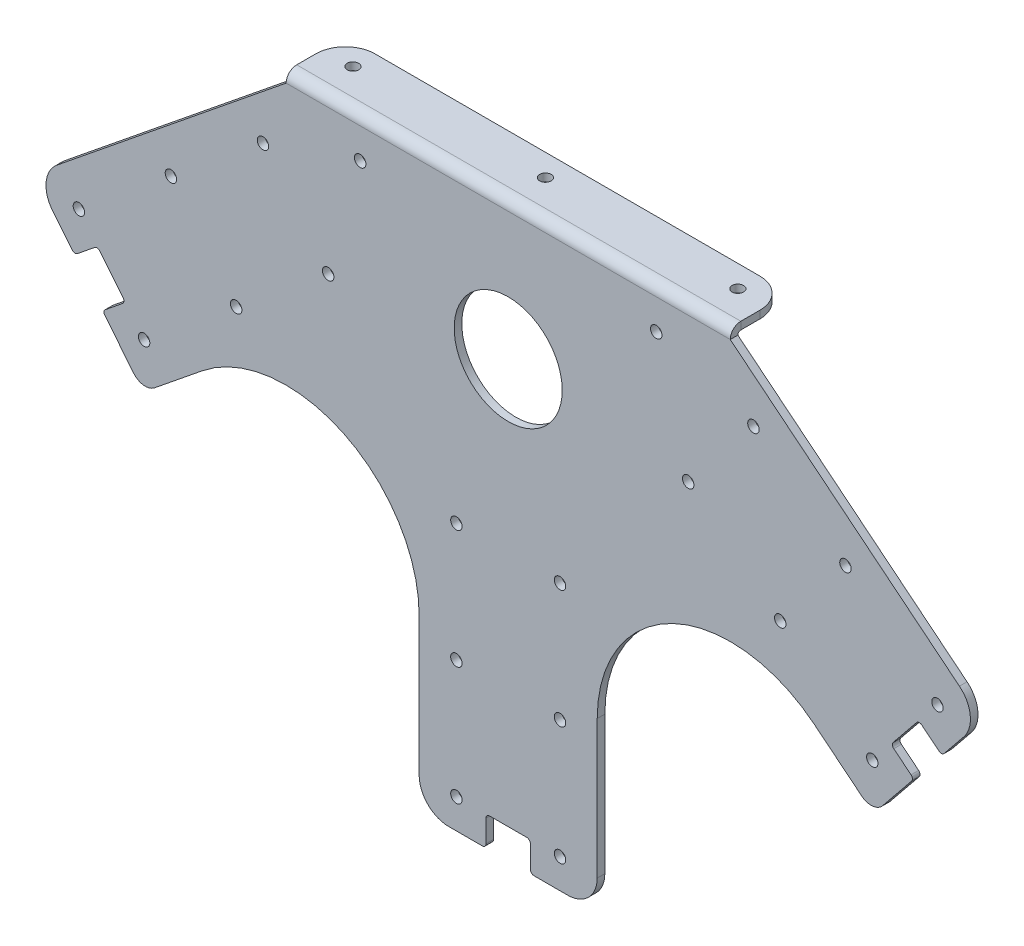
from build123d import *

# Parameters (mm, degrees)
SKETCH1_R                    = 23.1775
BASE_FLANGE1_DEPTH           = 3.2639
EDGE_FLANGE1_DEPTH           = 190.5
CUT_EXTRUDE1_DEPTH           = 278.067831524
CUT_EXTRUDE1_DEPTH_BACK      = 278.067831524
FILLET1_R                    = 57.15
F_10_0_1935_DIAMETER_HOLE2_D = 4.9149
F_10_0_1935_DIAMETER_HOLE1_D = 4.9149
SKETCH20_W                   = 19.05
SKETCH20_H                   = 12.7
CUT_EXTRUDE2_DEPTH           = 278.067831524
F_10_0_1935_DIAMETER_HOLE3_D = 4.9149
F_10_0_1935_DIAMETER_HOLE4_D = 4.9149
FILLET2_R                    = 12.7
FILLET3_R                    = 1.5875
FILLET4_R                    = 6.35


# Sheet-metal steps are written as plain solids
with BuildPart() as part:
    # Sketch1 → Base-Flange1 (new body)
    with BuildSketch(Plane.XY):
        Polygon((95.25, 54.9275), (-95.25, 54.9275), (-203.437249562, -32.68080729), (-156.625944526, -90.487954773), (-38.1889, -186.3725), (38.1889, -186.3725), (156.625944526, -90.487954773), (203.437249562, -32.68080729), align=None)
        Circle(SKETCH1_R, mode=Mode.SUBTRACT)
    extrude(amount=-BASE_FLANGE1_DEPTH)

    # Edge-Flange1 section (across the edge) → Edge-Flange1 (add)
    with BuildSketch(Plane(origin=(-95.25, 56.1975, -3.2639), x_dir=(0, -1, 0), z_dir=(1, 0, 0))):
        with BuildLine():
            Line((-3.2639, 1.27), (-3.2639, 22.1361))
            Line((-3.2639, 22.1361), (0, 22.1361))
            Line((0, 22.1361), (0, 1.27))
            ThreePointArc((0, 1.27), (0.371974388, 0.371974388), (1.27, 0))
            Line((1.27, 0), (1.27, -3.2639))
            ThreePointArc((1.27, -3.2639), (-1.935951435, -1.935951435), (-3.2639, 1.27))
        make_face()
    extrude(amount=EDGE_FLANGE1_DEPTH)

    # Sketch13 → Cut-Extrude1 (cut, two sides: drawn at the far end of the back side and taken through both)
    with BuildSketch(Plane.XY.offset(-CUT_EXTRUDE1_DEPTH_BACK)):
        Polygon((-156.625944526, -90.487954773), (-38.1889, 5.420472823), (-38.1889, -186.3725), align=None)
        Polygon((38.1889, -186.3725), (38.1889, 5.420472823), (156.625944526, -90.487954773), align=None)
    extrude(amount=CUT_EXTRUDE1_DEPTH + CUT_EXTRUDE1_DEPTH_BACK, mode=Mode.SUBTRACT)

    # Fillet1
    fillet1_edges = [part.edges().sort_by_distance(p)[0] for p in [
        (-38.1889, 5.420472823, -1.63195),
        (38.1889, 5.420472823, -1.63195),
    ]]
    fillet(fillet1_edges, radius=FILLET1_R)

    # #10 (0.1935) Diameter Hole2 (through all)
    with Locations(Plane.XY):
        with Locations((-144.669474183, -4.350467207), (-116.6961828, -38.894605193), (-77.217167958, -6.925129328), (-105.19045934, 27.619008659), (-156.175197642, -70.864081059), (-184.148489025, -36.319943072), (105.19045934, 27.619008659), (77.217167958, -6.925129328), (144.669474183, -4.350467207), (116.6961828, -38.894605193), (156.175197642, -70.864081059), (184.148489025, -36.319943072)):
            Hole(F_10_0_1935_DIAMETER_HOLE2_D / 2)

    # #10 (0.1935) Diameter Hole1 (through all)
    with Locations(Plane.XY):
        with Locations((-22.225, -173.6725), (-22.225, -122.8725), (-22.225, -72.0725), (22.225, -72.0725), (22.225, -122.8725), (22.225, -173.6725)):
            Hole(F_10_0_1935_DIAMETER_HOLE1_D / 2)

    # Sketch20 → Cut-Extrude2 (cut, through all)
    with BuildSketch(Plane.XY):
        Polygon((-186.025873769, -54.182065749), (-176.156120058, -46.189696782), (-164.167566609, -60.994327348), (-174.037320319, -68.986696315), align=None)
        with Locations((0, -180.0225)):
            Rectangle(SKETCH20_W, SKETCH20_H)
        Polygon((174.037320319, -68.986696315), (164.167566609, -60.994327348), (176.156120058, -46.189696782), (186.025873769, -54.182065749), align=None)
    extrude(amount=-CUT_EXTRUDE2_DEPTH, mode=Mode.SUBTRACT)

    # #10 (0.1935) Diameter Hole3 (through all)
    with Locations(Plane(origin=(0, 59.4614, 0), x_dir=(1, 0, 0), z_dir=(0, 1, 0))):
        with Locations((-82.55, 15.9639), (0, 15.9639), (82.55, 15.9639)):
            Hole(F_10_0_1935_DIAMETER_HOLE3_D / 2)

    # #10 (0.1935) Diameter Hole4 (through all)
    with Locations(Plane.XY):
        with Locations((-63.5, 41.91), (63.5, 41.91)):
            Hole(F_10_0_1935_DIAMETER_HOLE4_D / 2)

    # Fillet2
    fillet2_edges = [part.edges().sort_by_distance(p)[0] for p in [
        (203.437249562, -32.68080729, -1.63195),
        (38.1889, -186.3725, -1.63195),
        (-38.1889, -186.3725, -1.63195),
        (-203.437249562, -32.68080729, -1.63195),
        (-95.25, 57.82945, -25.4),
        (95.25, 57.82945, -25.4),
    ]]
    fillet(fillet2_edges, radius=FILLET2_R)

    # Fillet3
    fillet3_edges = [part.edges().sort_by_distance(p)[0] for p in [
        (-174.037320319, -68.986696315, -1.63195),
        (-186.025873769, -54.182065749, -1.63195),
        (9.525, -186.3725, -1.63195),
        (-9.525, -186.3725, -1.63195),
        (186.025873769, -54.182065749, -1.63195),
        (174.037320319, -68.986696315, -1.63195),
        (-176.156120058, -46.189696782, -1.63195),
        (-164.167566609, -60.994327348, -1.63195),
        (-9.525, -173.6725, -1.63195),
        (9.525, -173.6725, -1.63195),
        (164.167566609, -60.994327348, -1.63195),
        (176.156120058, -46.189696782, -1.63195),
    ]]
    fillet(fillet3_edges, radius=FILLET3_R)

    # Fillet4
    fillet4_edges = [part.edges().sort_by_distance(p)[0] for p in [
        (156.625944526, -90.487954773, -1.63195),
        (-156.625944526, -90.487954773, -1.63195),
    ]]
    fillet(fillet4_edges, radius=FILLET4_R)


solid = part.part
